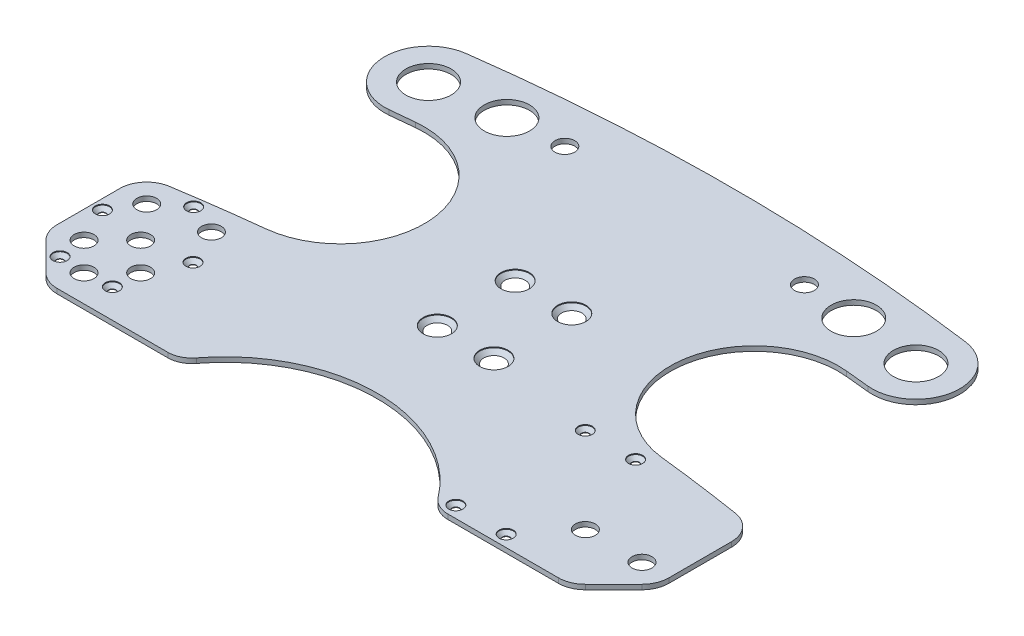
from build123d import *

# Parameters (mm, degrees)
SKETCH1_R                                      = 2.5
BOSS_EXTRUDE1_DEPTH                            = 1.7
CUT_EXTRUDE1_REACH                             = 155.062
SKETCH2_R                                      = 3.5
SKETCH2_R_2                                    = 8
CUT_EXTRUDE2_REACH                             = 155.062
SKETCH3_R                                      = 1.3
FILLET1_R                                      = 8.5
CUT_EXTRUDE3_REACH                             = 136.744
SKETCH8_R                                      = 1.25
CSK_FOR_M5_FLAT_HEAD_MACHINE_SCREW1_AT_2_COUNT = 2
CSK_FOR_M5_FLAT_HEAD_MACHINE_SCREW1_AT_2_PITCH = 20
CSK_FOR_M5_FLAT_HEAD_MACHINE_SCREW1_AT_3_COUNT = 2
CSK_FOR_M5_FLAT_HEAD_MACHINE_SCREW1_AT_3_PITCH = 34.003676272
CSK_FOR_M5_FLAT_HEAD_MACHINE_SCREW1_AT_4_COUNT = 2
CSK_FOR_M5_FLAT_HEAD_MACHINE_SCREW1_AT_4_PITCH = 27.5
CSK_FOR_M2_5_FLAT_HEAD_MACHINE_SCREW1_AT_COUNT = 2
CSK_FOR_M2_5_FLAT_HEAD_MACHINE_SCREW1_AT_PITCH = 17.78
CSK_FOR_M2_5_FLAT_HEAD_MACHINE_SCREW_2_COUNT   = 2
CSK_FOR_M2_5_FLAT_HEAD_MACHINE_SCREW_2_PITCH   = 49.055548106
CSK_FOR_M2_5_FLAT_HEAD_MACHINE_SCREW_3_COUNT   = 2
CSK_FOR_M2_5_FLAT_HEAD_MACHINE_SCREW_3_PITCH   = 45.72
CSK_FOR_M2_5_FLAT_HEAD_MACHINE_SCREW_4_COUNT   = 2
CSK_FOR_M2_5_FLAT_HEAD_MACHINE_SCREW_4_PITCH   = 137.555030632
CSK_FOR_M2_5_FLAT_HEAD_MACHINE_SCREW_5_COUNT   = 2
CSK_FOR_M2_5_FLAT_HEAD_MACHINE_SCREW_5_PITCH   = 122.005515158
CSK_FOR_M2_5_FLAT_HEAD_MACHINE_SCREW_6_COUNT   = 2
CSK_FOR_M2_5_FLAT_HEAD_MACHINE_SCREW_6_PITCH   = 153.732178243
CSK_FOR_M2_5_FLAT_HEAD_MACHINE_SCREW_7_COUNT   = 2
CSK_FOR_M2_5_FLAT_HEAD_MACHINE_SCREW_7_PITCH   = 151.211955401
CSK_FOR_M2_5_FLAT_HEAD_MACHINE_SCREW_8_COUNT   = 2
CSK_FOR_M2_5_FLAT_HEAD_MACHINE_SCREW_8_PITCH   = 133.459749785


with BuildPart() as part:
    # Sketch1 → Boss-Extrude1 (new body)
    with BuildSketch(Plane(origin=(0, 0, 0), x_dir=(1, 0, 0), z_dir=(0, 1, 0))):
        with BuildLine():
            Line((-73.314391493, -95), (73.314391493, -95))
            ThreePointArc((73.314391493, -95), (120, 0), (73.314391493, 95))
            Line((73.314391493, 95), (-73.314391493, 95))
            ThreePointArc((-73.314391493, 95), (-120, 0), (-73.314391493, -95))
        make_face()
        with Locations((-10, 13.75)):
            Circle(SKETCH1_R, mode=Mode.SUBTRACT)
        with Locations((-10, -13.75)):
            Circle(SKETCH1_R, mode=Mode.SUBTRACT)
        with Locations((10, -13.75)):
            Circle(SKETCH1_R, mode=Mode.SUBTRACT)
        with Locations((10, 13.75)):
            Circle(SKETCH1_R, mode=Mode.SUBTRACT)
    extrude(amount=BOSS_EXTRUDE1_DEPTH)

    # Sketch2 → Cut-Extrude1 (cut, up to next)
    with BuildSketch(Plane(origin=(0, 1.7, 0), x_dir=(1, 0, 0), z_dir=(0, 1, 0)), mode=Mode.PRIVATE) as cut_extrude1_sk1:
        with Locations((-88.540600769, -40)):
            Circle(SKETCH2_R)
    cut_extrude1_tool1 = extrude(cut_extrude1_sk1.sketch, amount=-CUT_EXTRUDE1_REACH, mode=Mode.PRIVATE) & part.part
    # Sketch2 → Cut-Extrude1 (cut, up to next)
    with BuildSketch(Plane(origin=(0, 1.7, 0), x_dir=(1, 0, 0), z_dir=(0, 1, 0)), mode=Mode.PRIVATE) as cut_extrude1_sk2:
        with Locations((-78.540600769, -50)):
            Circle(SKETCH2_R)
    cut_extrude1_tool2 = extrude(cut_extrude1_sk2.sketch, amount=-CUT_EXTRUDE1_REACH, mode=Mode.PRIVATE) & part.part
    # Sketch2 → Cut-Extrude1 (cut, up to next)
    with BuildSketch(Plane(origin=(0, 1.7, 0), x_dir=(1, 0, 0), z_dir=(0, 1, 0)), mode=Mode.PRIVATE) as cut_extrude1_sk3:
        with Locations((-88.540600769, -60)):
            Circle(SKETCH2_R)
    cut_extrude1_tool3 = extrude(cut_extrude1_sk3.sketch, amount=-CUT_EXTRUDE1_REACH, mode=Mode.PRIVATE) & part.part
    # Sketch2 → Cut-Extrude1 (cut, up to next)
    with BuildSketch(Plane(origin=(0, 1.7, 0), x_dir=(1, 0, 0), z_dir=(0, 1, 0)), mode=Mode.PRIVATE) as cut_extrude1_sk4:
        with Locations((-98.540600769, -50)):
            Circle(SKETCH2_R)
    cut_extrude1_tool4 = extrude(cut_extrude1_sk4.sketch, amount=-CUT_EXTRUDE1_REACH, mode=Mode.PRIVATE) & part.part
    # Sketch2 → Cut-Extrude1 (cut, up to next)
    with BuildSketch(Plane(origin=(0, 1.7, 0), x_dir=(1, 0, 0), z_dir=(0, 1, 0)), mode=Mode.PRIVATE) as cut_extrude1_sk5:
        with Locations((78.540600769, -50)):
            Circle(SKETCH2_R)
    cut_extrude1_tool5 = extrude(cut_extrude1_sk5.sketch, amount=-CUT_EXTRUDE1_REACH, mode=Mode.PRIVATE) & part.part
    # Sketch2 → Cut-Extrude1 (cut, up to next)
    with BuildSketch(Plane(origin=(0, 1.7, 0), x_dir=(1, 0, 0), z_dir=(0, 1, 0)), mode=Mode.PRIVATE) as cut_extrude1_sk6:
        with Locations((98.540600769, -50)):
            Circle(SKETCH2_R)
    cut_extrude1_tool6 = extrude(cut_extrude1_sk6.sketch, amount=-CUT_EXTRUDE1_REACH, mode=Mode.PRIVATE) & part.part
    # Sketch2 → Cut-Extrude1 (cut, up to next)
    with BuildSketch(Plane(origin=(0, 1.7, 0), x_dir=(1, 0, 0), z_dir=(0, 1, 0)), mode=Mode.PRIVATE) as cut_extrude1_sk7:
        with Locations((-98.540600769, -27.862546721)):
            Circle(SKETCH2_R)
    cut_extrude1_tool7 = extrude(cut_extrude1_sk7.sketch, amount=-CUT_EXTRUDE1_REACH, mode=Mode.PRIVATE) & part.part
    # Sketch2 → Cut-Extrude1 (cut, up to next)
    with BuildSketch(Plane(origin=(0, 1.7, 0), x_dir=(1, 0, 0), z_dir=(0, 1, 0)), mode=Mode.PRIVATE) as cut_extrude1_sk8:
        with Locations((-78.540600769, -25)):
            Circle(SKETCH2_R)
    cut_extrude1_tool8 = extrude(cut_extrude1_sk8.sketch, amount=-CUT_EXTRUDE1_REACH, mode=Mode.PRIVATE) & part.part
    # Sketch2 → Cut-Extrude1 (cut, up to next)
    with BuildSketch(Plane(origin=(0, 1.7, 0), x_dir=(1, 0, 0), z_dir=(0, 1, 0)), mode=Mode.PRIVATE) as cut_extrude1_sk9:
        with Locations((-86.094520408, 59.228232759)):
            Circle(SKETCH2_R_2)
    cut_extrude1_tool9 = extrude(cut_extrude1_sk9.sketch, amount=-CUT_EXTRUDE1_REACH, mode=Mode.PRIVATE) & part.part
    # Sketch2 → Cut-Extrude1 (cut, up to next)
    with BuildSketch(Plane(origin=(0, 1.7, 0), x_dir=(1, 0, 0), z_dir=(0, 1, 0)), mode=Mode.PRIVATE) as cut_extrude1_sk10:
        with Locations((-61.259580586, 62.084312054)):
            Circle(SKETCH2_R_2)
    cut_extrude1_tool10 = extrude(cut_extrude1_sk10.sketch, amount=-CUT_EXTRUDE1_REACH, mode=Mode.PRIVATE) & part.part
    # Sketch2 → Cut-Extrude1 (cut, up to next)
    with BuildSketch(Plane(origin=(0, 1.7, 0), x_dir=(1, 0, 0), z_dir=(0, 1, 0)), mode=Mode.PRIVATE) as cut_extrude1_sk11:
        with Locations((61.259580586, 62.084312054)):
            Circle(SKETCH2_R_2)
    cut_extrude1_tool11 = extrude(cut_extrude1_sk11.sketch, amount=-CUT_EXTRUDE1_REACH, mode=Mode.PRIVATE) & part.part
    # Sketch2 → Cut-Extrude1 (cut, up to next)
    with BuildSketch(Plane(origin=(0, 1.7, 0), x_dir=(1, 0, 0), z_dir=(0, 1, 0)), mode=Mode.PRIVATE) as cut_extrude1_sk12:
        with Locations((86.094520408, 59.228232759)):
            Circle(SKETCH2_R_2)
    cut_extrude1_tool12 = extrude(cut_extrude1_sk12.sketch, amount=-CUT_EXTRUDE1_REACH, mode=Mode.PRIVATE) & part.part
    # Sketch2 → Cut-Extrude1 (cut, up to next)
    with BuildSketch(Plane(origin=(0, 1.7, 0), x_dir=(1, 0, 0), z_dir=(0, 1, 0)), mode=Mode.PRIVATE) as cut_extrude1_sk13:
        with Locations((-42.320942156, 63.610082158)):
            Circle(SKETCH2_R)
    cut_extrude1_tool13 = extrude(cut_extrude1_sk13.sketch, amount=-CUT_EXTRUDE1_REACH, mode=Mode.PRIVATE) & part.part
    # Sketch2 → Cut-Extrude1 (cut, up to next)
    with BuildSketch(Plane(origin=(0, 1.7, 0), x_dir=(1, 0, 0), z_dir=(0, 1, 0)), mode=Mode.PRIVATE) as cut_extrude1_sk14:
        with Locations((42.320942156, 63.610082158)):
            Circle(SKETCH2_R)
    cut_extrude1_tool14 = extrude(cut_extrude1_sk14.sketch, amount=-CUT_EXTRUDE1_REACH, mode=Mode.PRIVATE) & part.part
    add(cut_extrude1_tool1.solids().sort_by_distance((-88.540601, 1.7, 40))[0], mode=Mode.SUBTRACT)
    add(cut_extrude1_tool2.solids().sort_by_distance((-78.540601, 1.7, 50))[0], mode=Mode.SUBTRACT)
    add(cut_extrude1_tool3.solids().sort_by_distance((-88.540601, 1.7, 60))[0], mode=Mode.SUBTRACT)
    add(cut_extrude1_tool4.solids().sort_by_distance((-98.540601, 1.7, 50))[0], mode=Mode.SUBTRACT)
    add(cut_extrude1_tool5.solids().sort_by_distance((78.540601, 1.7, 50))[0], mode=Mode.SUBTRACT)
    add(cut_extrude1_tool6.solids().sort_by_distance((98.540601, 1.7, 50))[0], mode=Mode.SUBTRACT)
    add(cut_extrude1_tool7.solids().sort_by_distance((-98.540601, 1.7, 27.862547))[0], mode=Mode.SUBTRACT)
    add(cut_extrude1_tool8.solids().sort_by_distance((-78.540601, 1.7, 25))[0], mode=Mode.SUBTRACT)
    add(cut_extrude1_tool9.solids().sort_by_distance((-86.09452, 1.7, -59.228233))[0], mode=Mode.SUBTRACT)
    add(cut_extrude1_tool10.solids().sort_by_distance((-61.259581, 1.7, -62.084312))[0], mode=Mode.SUBTRACT)
    add(cut_extrude1_tool11.solids().sort_by_distance((61.259581, 1.7, -62.084312))[0], mode=Mode.SUBTRACT)
    add(cut_extrude1_tool12.solids().sort_by_distance((86.09452, 1.7, -59.228233))[0], mode=Mode.SUBTRACT)
    add(cut_extrude1_tool13.solids().sort_by_distance((-42.320942, 1.7, -63.610082))[0], mode=Mode.SUBTRACT)
    add(cut_extrude1_tool14.solids().sort_by_distance((42.320942, 1.7, -63.610082))[0], mode=Mode.SUBTRACT)

    # Sketch3 → Cut-Extrude2 (cut, up to next)
    with BuildSketch(Plane(origin=(0, 1.7, 0), x_dir=(1, 0, 0), z_dir=(0, 1, 0)), mode=Mode.PRIVATE) as cut_extrude2_sk1:
        with BuildLine():
            Line((-76.105927639, 44.650651409), (-84.550645906, 43.805313077))
            ThreePointArc((-84.550645906, 43.805313077), (-99.436668511, 51.3391844), (-98.864520746, 68.013282068))
            ThreePointArc((-98.864520746, 68.013282068), (-119.734623685, 7.97620781), (-107.012417284, -54.298642221))
            ThreePointArc((-107.012417284, -54.298642221), (-107.779979993, -52.209948315), (-108.040600769, -50))
            Line((-108.040600769, -50), (-108.040600769, -27.862546721))
            ThreePointArc((-108.040600769, -27.862546721), (-105.768300058, -21.697292226), (-100.038419088, -18.48136661))
            ThreePointArc((-100.038419088, -18.48136661), (-84.982869073, -16.262381047), (-69.878431936, -14.405108326))
            ThreePointArc((-69.878431936, -14.405108326), (-43.620166551, 18.220083083), (-76.105927639, 44.650651409))
        make_face()
    cut_extrude2_tool1 = extrude(cut_extrude2_sk1.sketch, amount=-CUT_EXTRUDE2_REACH, mode=Mode.PRIVATE) & part.part
    # Sketch3 → Cut-Extrude2 (cut, up to next)
    with BuildSketch(Plane(origin=(0, 1.7, 0), x_dir=(1, 0, 0), z_dir=(0, 1, 0)), mode=Mode.PRIVATE) as cut_extrude2_sk2:
        with BuildLine():
            ThreePointArc((-98.864520746, 68.013282068), (-94.209947077, 72.433907674), (-88.163438842, 74.589534022))
            ThreePointArc((-88.163438842, 74.589534022), (2.1e-08, 80.5), (88.163438884, 74.589534017))
            ThreePointArc((88.163438884, 74.589534017), (94.209947407, 72.433907471), (98.864521161, 68.013281465))
            ThreePointArc((98.864521161, 68.013281465), (87.140491363, 82.50172583), (73.314391493, 95))
            Line((73.314391493, 95), (-73.314391493, 95))
            ThreePointArc((-73.314391493, 95), (-87.140491112, 82.501726096), (-98.864520746, 68.013282068))
        make_face()
    cut_extrude2_tool2 = extrude(cut_extrude2_sk2.sketch, amount=-CUT_EXTRUDE2_REACH, mode=Mode.PRIVATE) & part.part
    # Sketch3 → Cut-Extrude2 (cut, up to next)
    with BuildSketch(Plane(origin=(0, 1.7, 0), x_dir=(1, 0, 0), z_dir=(0, 1, 0)), mode=Mode.PRIVATE) as cut_extrude2_sk3:
        with BuildLine():
            ThreePointArc((-105.258115191, -56.717514421), (-106.230963521, -55.577483371), (-107.012417284, -54.298642221))
            ThreePointArc((-107.012417284, -54.298642221), (-92.431540192, -76.527187181), (-73.314391493, -95))
            Line((-73.314391493, -95), (73.314391493, -95))
            ThreePointArc((73.314391493, -95), (92.431540082, -76.527187314), (107.012417128, -54.298642528))
            ThreePointArc((107.012417128, -54.298642528), (106.23096342, -55.57748351), (105.258115191, -56.717514421))
            Line((105.258115191, -56.717514421), (95.258115191, -66.717514421))
            ThreePointArc((95.258115191, -66.717514421), (92.176093377, -68.776855559), (88.540600769, -69.5))
            Line((88.540600769, -69.5), (45.040600769, -69.5))
            ThreePointArc((45.040600769, -69.5), (0, -45), (-45.040600769, -69.5))
            Line((-45.040600769, -69.5), (-88.540600769, -69.5))
            ThreePointArc((-88.540600769, -69.5), (-92.176093377, -68.776855559), (-95.258115191, -66.717514421))
            Line((-95.258115191, -66.717514421), (-105.258115191, -56.717514421))
        make_face()
    cut_extrude2_tool3 = extrude(cut_extrude2_sk3.sketch, amount=-CUT_EXTRUDE2_REACH, mode=Mode.PRIVATE) & part.part
    # Sketch3 → Cut-Extrude2 (cut, up to next)
    with BuildSketch(Plane(origin=(0, 1.7, 0), x_dir=(1, 0, 0), z_dir=(0, 1, 0)), mode=Mode.PRIVATE) as cut_extrude2_sk4:
        with BuildLine():
            ThreePointArc((69.878433596, -14.40510851), (84.982869339, -16.262381083), (100.038417968, -18.481366431))
            ThreePointArc((100.038417968, -18.481366431), (105.768299691, -21.697291795), (108.040600769, -27.862546721))
            Line((108.040600769, -27.862546721), (108.040600769, -50))
            ThreePointArc((108.040600769, -50), (107.779979953, -52.209948483), (107.012417128, -54.298642528))
            ThreePointArc((107.012417128, -54.298642528), (119.734623721, 7.976207273), (98.864521161, 68.013281465))
            ThreePointArc((98.864521161, 68.013281465), (99.436668324, 51.339184085), (84.550645906, 43.805313077))
            Line((84.550645906, 43.805313077), (76.105927251, 44.650651448))
            ThreePointArc((76.105927251, 44.650651448), (43.620166443, 18.220082059), (69.878433596, -14.40510851))
        make_face()
    cut_extrude2_tool4 = extrude(cut_extrude2_sk4.sketch, amount=-CUT_EXTRUDE2_REACH, mode=Mode.PRIVATE) & part.part
    # Sketch3 → Cut-Extrude2 (cut, up to next)
    with BuildSketch(Plane(origin=(0, 1.7, 0), x_dir=(1, 0, 0), z_dir=(0, 1, 0)), mode=Mode.PRIVATE) as cut_extrude2_sk5:
        with Locations((48.150600769, -19.64)):
            Circle(SKETCH3_R)
    cut_extrude2_tool5 = extrude(cut_extrude2_sk5.sketch, amount=-CUT_EXTRUDE2_REACH, mode=Mode.PRIVATE) & part.part
    # Sketch3 → Cut-Extrude2 (cut, up to next)
    with BuildSketch(Plane(origin=(0, 1.7, 0), x_dir=(1, 0, 0), z_dir=(0, 1, 0)), mode=Mode.PRIVATE) as cut_extrude2_sk6:
        with Locations((65.930600769, -19.64)):
            Circle(SKETCH3_R)
    cut_extrude2_tool6 = extrude(cut_extrude2_sk6.sketch, amount=-CUT_EXTRUDE2_REACH, mode=Mode.PRIVATE) & part.part
    # Sketch3 → Cut-Extrude2 (cut, up to next)
    with BuildSketch(Plane(origin=(0, 1.7, 0), x_dir=(1, 0, 0), z_dir=(0, 1, 0)), mode=Mode.PRIVATE) as cut_extrude2_sk7:
        with Locations((65.930600769, -65.36)):
            Circle(SKETCH3_R)
    cut_extrude2_tool7 = extrude(cut_extrude2_sk7.sketch, amount=-CUT_EXTRUDE2_REACH, mode=Mode.PRIVATE) & part.part
    # Sketch3 → Cut-Extrude2 (cut, up to next)
    with BuildSketch(Plane(origin=(0, 1.7, 0), x_dir=(1, 0, 0), z_dir=(0, 1, 0)), mode=Mode.PRIVATE) as cut_extrude2_sk8:
        with Locations((48.150600769, -65.36)):
            Circle(SKETCH3_R)
    cut_extrude2_tool8 = extrude(cut_extrude2_sk8.sketch, amount=-CUT_EXTRUDE2_REACH, mode=Mode.PRIVATE) & part.part
    add(cut_extrude2_tool1.solids().sort_by_distance((-86.043963, 1.7, -12.513289))[0], mode=Mode.SUBTRACT)
    add(cut_extrude2_tool2.solids().sort_by_distance((0, 1.7, -86.177495))[0], mode=Mode.SUBTRACT)
    add(cut_extrude2_tool3.solids().sort_by_distance((0, 1.7, 75.736765))[0], mode=Mode.SUBTRACT)
    add(cut_extrude2_tool4.solids().sort_by_distance((86.043963, 1.7, -12.513289))[0], mode=Mode.SUBTRACT)
    add(cut_extrude2_tool5.solids().sort_by_distance((48.150601, 1.7, 19.64))[0], mode=Mode.SUBTRACT)
    add(cut_extrude2_tool6.solids().sort_by_distance((65.930601, 1.7, 19.64))[0], mode=Mode.SUBTRACT)
    add(cut_extrude2_tool7.solids().sort_by_distance((65.930601, 1.7, 65.36))[0], mode=Mode.SUBTRACT)
    add(cut_extrude2_tool8.solids().sort_by_distance((48.150601, 1.7, 65.36))[0], mode=Mode.SUBTRACT)

    # Fillet1
    fillet1_edges = [part.edges().sort_by_distance(p)[0] for p in [
        (45.040600769, 0.85, 69.5),
        (-45.040600769, 0.85, 69.5),
    ]]
    fillet(fillet1_edges, radius=FILLET1_R)

    # Sketch8 → Cut-Extrude3 (cut, up to next)
    with BuildSketch(Plane(origin=(0, 1.7, 0), x_dir=(1, 0, 0), z_dir=(0, 1, 0)), mode=Mode.PRIVATE) as cut_extrude3_sk1:
        with Locations((-89.402269215, -20.410980738)):
            Circle(SKETCH8_R)
    cut_extrude3_tool1 = extrude(cut_extrude3_sk1.sketch, amount=-CUT_EXTRUDE3_REACH, mode=Mode.PRIVATE) & part.part
    # Sketch8 → Cut-Extrude3 (cut, up to next)
    with BuildSketch(Plane(origin=(0, 1.7, 0), x_dir=(1, 0, 0), z_dir=(0, 1, 0)), mode=Mode.PRIVATE) as cut_extrude3_sk2:
        with Locations((-104.540600769, -37.5)):
            Circle(SKETCH8_R)
    cut_extrude3_tool2 = extrude(cut_extrude3_sk2.sketch, amount=-CUT_EXTRUDE3_REACH, mode=Mode.PRIVATE) & part.part
    # Sketch8 → Cut-Extrude3 (cut, up to next)
    with BuildSketch(Plane(origin=(0, 1.7, 0), x_dir=(1, 0, 0), z_dir=(0, 1, 0)), mode=Mode.PRIVATE) as cut_extrude3_sk3:
        with Locations((-72.540600769, -37.5)):
            Circle(SKETCH8_R)
    cut_extrude3_tool3 = extrude(cut_extrude3_sk3.sketch, amount=-CUT_EXTRUDE3_REACH, mode=Mode.PRIVATE) & part.part
    # Sketch8 → Cut-Extrude3 (cut, up to next)
    with BuildSketch(Plane(origin=(0, 1.7, 0), x_dir=(1, 0, 0), z_dir=(0, 1, 0)), mode=Mode.PRIVATE) as cut_extrude3_sk4:
        with Locations((-97.783241457, -59.242640687)):
            Circle(SKETCH8_R)
    cut_extrude3_tool4 = extrude(cut_extrude3_sk4.sketch, amount=-CUT_EXTRUDE3_REACH, mode=Mode.PRIVATE) & part.part
    # Sketch8 → Cut-Extrude3 (cut, up to next)
    with BuildSketch(Plane(origin=(0, 1.7, 0), x_dir=(1, 0, 0), z_dir=(0, 1, 0)), mode=Mode.PRIVATE) as cut_extrude3_sk5:
        with Locations((-79.297960082, -59.242640687)):
            Circle(SKETCH8_R)
    cut_extrude3_tool5 = extrude(cut_extrude3_sk5.sketch, amount=-CUT_EXTRUDE3_REACH, mode=Mode.PRIVATE) & part.part
    add(cut_extrude3_tool1.solids().sort_by_distance((-89.402269, 1.7, 20.410981))[0], mode=Mode.SUBTRACT)
    add(cut_extrude3_tool2.solids().sort_by_distance((-104.540601, 1.7, 37.5))[0], mode=Mode.SUBTRACT)
    add(cut_extrude3_tool3.solids().sort_by_distance((-72.540601, 1.7, 37.5))[0], mode=Mode.SUBTRACT)
    add(cut_extrude3_tool4.solids().sort_by_distance((-97.783241, 1.7, 59.242641))[0], mode=Mode.SUBTRACT)
    add(cut_extrude3_tool5.solids().sort_by_distance((-79.29796, 1.7, 59.242641))[0], mode=Mode.SUBTRACT)

    # Sketch5 → CSK for M5 Flat Head Machine Screw1 (revolve, cut)
    with BuildSketch(Plane(origin=(-10, 1.7, -13.75), x_dir=(0, 0, 1), z_dir=(1, 0, 0))):
        Polygon((0, 0), (0, 6.502151548), (2.5, 5), (2.5, 2.8), (5, 0.3), (5, 0), align=None)
    csk_for_m5_flat_head_machine_screw1 = revolve(axis=Axis((-10, 8.05, -13.75), (0, -1, 0)), mode=Mode.SUBTRACT)

    # CSK for M5 Flat Head Machine Screw1 at 2: CSK for M5 Flat Head Machine Screw1 ×2
    with Locations(*[(i * CSK_FOR_M5_FLAT_HEAD_MACHINE_SCREW1_AT_2_PITCH, 0, 0) for i in range(1, CSK_FOR_M5_FLAT_HEAD_MACHINE_SCREW1_AT_2_COUNT)]):
        add(csk_for_m5_flat_head_machine_screw1, mode=Mode.SUBTRACT)

    # CSK for M5 Flat Head Machine Screw1 at 3: CSK for M5 Flat Head Machine Screw1 ×2
    with Locations(*[Vector(0.5881716976750462, 0, 0.8087360843031886) * (i * CSK_FOR_M5_FLAT_HEAD_MACHINE_SCREW1_AT_3_PITCH) for i in range(1, CSK_FOR_M5_FLAT_HEAD_MACHINE_SCREW1_AT_3_COUNT)]):
        add(csk_for_m5_flat_head_machine_screw1, mode=Mode.SUBTRACT)

    # CSK for M5 Flat Head Machine Screw1 at 4: CSK for M5 Flat Head Machine Screw1 ×2
    with Locations(*[(0, 0, i * CSK_FOR_M5_FLAT_HEAD_MACHINE_SCREW1_AT_4_PITCH) for i in range(1, CSK_FOR_M5_FLAT_HEAD_MACHINE_SCREW1_AT_4_COUNT)]):
        add(csk_for_m5_flat_head_machine_screw1, mode=Mode.SUBTRACT)

    # Sketch7 → CSK for M2.5 Flat Head Machine Screw1 (revolve, cut)
    with BuildSketch(Plane(origin=(48.150600769, 1.7, 19.64), x_dir=(0, 0, 1), z_dir=(1, 0, 0))):
        Polygon((0, 0), (0, 5.751075774), (1.25, 5), (1.25, 1.55), (2.5, 0.3), (2.5, 0), align=None)
    csk_for_m2_5_flat_head_machine_screw1 = revolve(axis=Axis((48.150600769, 8.05, 19.64), (0, -1, 0)), mode=Mode.SUBTRACT)

    # CSK for M2.5 Flat Head Machine Screw1 at: CSK for M2.5 Flat Head Machine Screw1 ×2
    with Locations(*[(i * CSK_FOR_M2_5_FLAT_HEAD_MACHINE_SCREW1_AT_PITCH, 0, 0) for i in range(1, CSK_FOR_M2_5_FLAT_HEAD_MACHINE_SCREW1_AT_COUNT)]):
        add(csk_for_m2_5_flat_head_machine_screw1, mode=Mode.SUBTRACT)

    # CSK for M2.5 Flat Head Machine Screw 2: CSK for M2.5 Flat Head Machine Screw1 ×2
    with Locations(*[Vector(0.3624462611549487, 0, 0.9320046715412958) * (i * CSK_FOR_M2_5_FLAT_HEAD_MACHINE_SCREW_2_PITCH) for i in range(1, CSK_FOR_M2_5_FLAT_HEAD_MACHINE_SCREW_2_COUNT)]):
        add(csk_for_m2_5_flat_head_machine_screw1, mode=Mode.SUBTRACT)

    # CSK for M2.5 Flat Head Machine Screw 3: CSK for M2.5 Flat Head Machine Screw1 ×2
    with Locations(*[(0, 0, i * CSK_FOR_M2_5_FLAT_HEAD_MACHINE_SCREW_3_PITCH) for i in range(1, CSK_FOR_M2_5_FLAT_HEAD_MACHINE_SCREW_3_COUNT)]):
        add(csk_for_m2_5_flat_head_machine_screw1, mode=Mode.SUBTRACT)

    # CSK for M2.5 Flat Head Machine Screw 4: CSK for M2.5 Flat Head Machine Screw1 ×2
    with Locations(*[Vector(-0.999984292483863, 0, 0.005604889432271748) * (i * CSK_FOR_M2_5_FLAT_HEAD_MACHINE_SCREW_4_PITCH) for i in range(1, CSK_FOR_M2_5_FLAT_HEAD_MACHINE_SCREW_4_COUNT)]):
        add(csk_for_m2_5_flat_head_machine_screw1, mode=Mode.SUBTRACT)

    # CSK for M2.5 Flat Head Machine Screw 5: CSK for M2.5 Flat Head Machine Screw1 ×2
    with Locations(*[Vector(-0.9892274245378749, 0, 0.14638682502931377) * (i * CSK_FOR_M2_5_FLAT_HEAD_MACHINE_SCREW_5_PITCH) for i in range(1, CSK_FOR_M2_5_FLAT_HEAD_MACHINE_SCREW_5_COUNT)]):
        add(csk_for_m2_5_flat_head_machine_screw1, mode=Mode.SUBTRACT)

    # CSK for M2.5 Flat Head Machine Screw 6: CSK for M2.5 Flat Head Machine Screw1 ×2
    with Locations(*[Vector(-0.9932286349144532, 0, 0.1161760680431725) * (i * CSK_FOR_M2_5_FLAT_HEAD_MACHINE_SCREW_6_PITCH) for i in range(1, CSK_FOR_M2_5_FLAT_HEAD_MACHINE_SCREW_6_COUNT)]):
        add(csk_for_m2_5_flat_head_machine_screw1, mode=Mode.SUBTRACT)

    # CSK for M2.5 Flat Head Machine Screw 7: CSK for M2.5 Flat Head Machine Screw1 ×2
    with Locations(*[Vector(-0.9650946040533703, 0, 0.2619015181839699) * (i * CSK_FOR_M2_5_FLAT_HEAD_MACHINE_SCREW_7_PITCH) for i in range(1, CSK_FOR_M2_5_FLAT_HEAD_MACHINE_SCREW_7_COUNT)]):
        add(csk_for_m2_5_flat_head_machine_screw1, mode=Mode.SUBTRACT)

    # CSK for M2.5 Flat Head Machine Screw 8: CSK for M2.5 Flat Head Machine Screw1 ×2
    with Locations(*[Vector(-0.9549587876301365, 0, 0.2967384604798977) * (i * CSK_FOR_M2_5_FLAT_HEAD_MACHINE_SCREW_8_PITCH) for i in range(1, CSK_FOR_M2_5_FLAT_HEAD_MACHINE_SCREW_8_COUNT)]):
        add(csk_for_m2_5_flat_head_machine_screw1, mode=Mode.SUBTRACT)


solid = part.part
